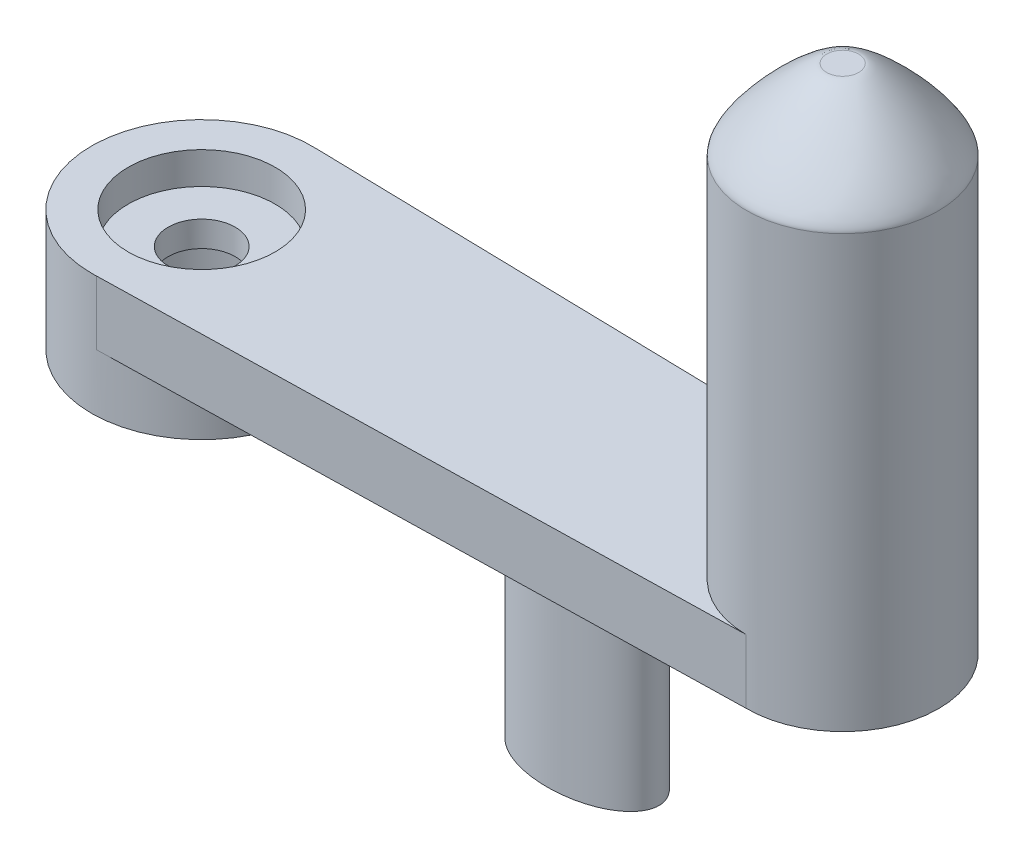
from build123d import *

# Parameters (mm, degrees)
ESBO_O1_R                = 3.45
RESSALTO_EXTRUS_O1_DEPTH = 1.4
ESBO_O2_R                = 3.45
RESSALTO_EXTRUS_O2_DEPTH = 2.4
FURO1_D                  = 4.95
FURO1_DEPTH              = 2
FURO2_D                  = 4.6
FURO2_DEPTH              = 1
FURO3_D                  = 2.1
BOSS_EXTRUDE1_DEPTH      = 2
SKETCH3_R                = 3
BOSS_EXTRUDE2_DEPTH      = 16
SKETCH4_RX               = 2.25
SKETCH4_RY               = 1.25
BOSS_EXTRUDE3_DEPTH      = 7
FILLET3_SIZE             = 2.5


with BuildPart() as part:
    # Esboço1 → Ressalto-extrusão1 (new body)
    with BuildSketch(Plane(origin=(0, 0, 0), x_dir=(1, 0, 0), z_dir=(0, 1, 0))):
        with Locations(Location((0, 0, 0), (0, 0, 270))):
            Circle(ESBO_O1_R)
    extrude(amount=-RESSALTO_EXTRUS_O1_DEPTH)

    # Esboço2 → Ressalto-extrusão2 (add)
    with BuildSketch(Plane.XZ.offset(1.4)):
        with Locations(Location((0, 0, 0), (0, 0, 90))):
            Circle(ESBO_O2_R)
    extrude(amount=RESSALTO_EXTRUS_O2_DEPTH)

    # Furo1
    with Locations(Plane(origin=(0, -3.8, 0), x_dir=(-1, 0, 0), z_dir=(0, -1, 0))):
        with Locations((0, 0)):
            Hole(FURO1_D / 2, depth=FURO1_DEPTH)

    # Furo2
    with Locations(Plane(origin=(0, 0, 0), x_dir=(1, 0, 0), z_dir=(0, 1, 0))):
        with Locations((0, 0)):
            Hole(FURO2_D / 2, depth=FURO2_DEPTH)

    # Furo3 (through all)
    with Locations(Plane(origin=(0, 0, 0), x_dir=(1, 0, 0), z_dir=(0, 1, 0))):
        with Locations((0, 0)):
            Hole(FURO3_D / 2)

    # Sketch2 → Boss-Extrude1 (add)
    with BuildSketch(Plane(origin=(0, 0, 0), x_dir=(1, 0, 0), z_dir=(0, 1, 0))):
        with BuildLine():
            Line((20.067369497, 2.999243463), (0.154910769, 3.446520369))
            ThreePointArc((0.154910769, 3.446520369), (2.493686243, 2.384120157), (3.45, 0))
            ThreePointArc((3.45, 0), (2.493686243, -2.384120157), (0.154910769, -3.446520369))
            Line((0.154910769, -3.446520369), (20.067369497, -2.999243463))
            ThreePointArc((20.067369497, -2.999243463), (23, 0), (20.067369497, 2.999243463))
        make_face()
    extrude(amount=-BOSS_EXTRUDE1_DEPTH)

    # Sketch3 → Boss-Extrude2 (add)
    with BuildSketch(Plane.XZ.offset(2)):
        with Locations(Location((20.067369497, 0, 0), (0, 0, 270))):
            Circle(SKETCH3_R)
    extrude(amount=-BOSS_EXTRUDE2_DEPTH)

    # Sketch4 → Boss-Extrude3 (add)
    with BuildSketch(Plane.XZ.offset(2)):
        with Locations((12.067369497, 0)):
            Ellipse(SKETCH4_RX, SKETCH4_RY)
    extrude(amount=BOSS_EXTRUDE3_DEPTH)

    # Fillet3
    # a fillet whose section is not a circle: 2.5 mm, written as the material it takes off along each edge
    with BuildSketch(Plane(origin=(20.067369497, 14, 0), x_dir=(0, 0, -1), z_dir=(-1, 0, 0))) as fillet3_piece_1:
        with BuildLine():
            Bezier((3, FILLET3_SIZE), (3, 0), (3 - FILLET3_SIZE, 0), weights=[1, 0.176470588, 1])
            Line((3 - FILLET3_SIZE, 0), (3, 0))
            Line((3, 0), (3, FILLET3_SIZE))
        make_face()
    revolve(axis=Axis((20.067369497, 14, 0), (0, -1, 0)), mode=Mode.SUBTRACT)


solid = part.part
